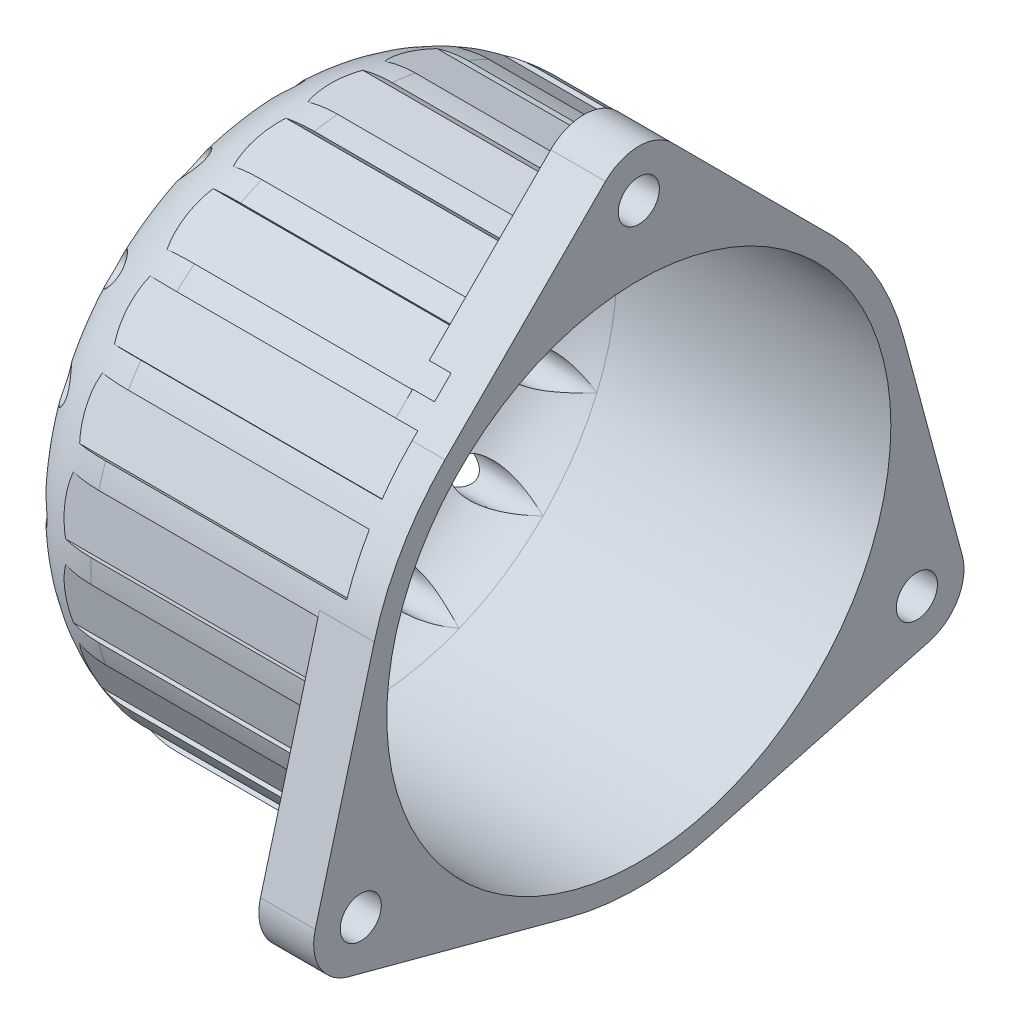
from build123d import *

# Parameters (mm, degrees)
SKETCH1_R               = 63.5
BOSS_EXTRUDE2_DEPTH     = 88.9
FILLET3_R               = 25.4
SHELL2_T                = 5.08
CUT_EXTRUDE1_START      = -5.08
SKETCH4_R               = 58.42
CUT_EXTRUDE1_DEPTH      = 5.08
CUT_EXTRUDE5_START      = -26
CUT_EXTRUDE5_OUTLINE_R  = 3.81
CUT_EXTRUDE5_DEPTH      = 26
CIRPATTERN3_START       = -1e-07
CIRPATTERN3_OUTLINE_R   = 3.81
CIRPATTERN3_DEPTH       = 26.0000001
BOSS_EXTRUDE3_START     = -12.7
SKETCH12_R              = 4.7625
BOSS_EXTRUDE3_DEPTH     = 12.7
CUT_EXTRUDE7_DEPTH      = 139.63281844
CUT_EXTRUDE7_DEPTH_BACK = 139.63281844
SKETCH13_R              = 10.16
SKETCH14_W              = 12.7
SKETCH14_H              = 2.54
CUT_EXTRUDE12_DEPTH     = 81.28
CIRPATTERN15_COUNT      = 22
CIRPATTERN18_COUNT      = 3


with BuildPart() as part:
    # Sketch1 → Boss-Extrude2 (new body)
    with BuildSketch(Plane(origin=(0, 0, 0), x_dir=(0, 0, -1), z_dir=(1, 0, 0))):
        Circle(SKETCH1_R)
    extrude(amount=BOSS_EXTRUDE2_DEPTH)

    # Fillet3
    fillet3_edges = [part.edges().sort_by_distance(p)[0] for p in [
        (0, 0, 63.5),
    ]]
    fillet(fillet3_edges, radius=FILLET3_R)

    # Shell2 (no face opened: a closed hollow body)
    add(offset(amount=-SHELL2_T, mode=Mode.PRIVATE), mode=Mode.SUBTRACT)

    # Sketch4 → Cut-Extrude1 (cut)
    with BuildSketch(Plane(origin=(88.9, 0, 0), x_dir=(0, 0, -1), z_dir=(1, 0, 0)).offset(CUT_EXTRUDE1_START)):
        with Locations(Location((0, 0, 0), (0, 0, 180))):
            Circle(SKETCH4_R)
    extrude(amount=CUT_EXTRUDE1_DEPTH, mode=Mode.SUBTRACT)

    # Cut-Extrude5: read off the stored shape, not the designer's step
    # Cut-Extrude5 outline → Cut-Extrude5 (cut)
    with BuildSketch(Plane.ZY.offset(CUT_EXTRUDE5_START)):
        with Locations((0, 54.61)):
            Circle(CUT_EXTRUDE5_OUTLINE_R)
        with Locations((-21.356899016, 50.260670155)):
            Circle(CUT_EXTRUDE5_OUTLINE_R)
        with Locations((-9.377034879, 46.044883721)):
            Circle(CUT_EXTRUDE5_OUTLINE_R)
        with Locations((9.377034879, 46.044883721)):
            Circle(CUT_EXTRUDE5_OUTLINE_R)
    extrude(amount=CUT_EXTRUDE5_DEPTH, mode=Mode.SUBTRACT)

    # CirPattern3: read off the stored shape, not the designer's step
    # CirPattern3 outline → CirPattern3 (cut)
    with BuildSketch(Plane.YZ.offset(CIRPATTERN3_START)):
        with Locations((25.928084568, 39.189214469)):
            Circle(CIRPATTERN3_OUTLINE_R)
        with Locations((-9.377034879, 46.044883721)):
            Circle(CIRPATTERN3_OUTLINE_R)
        with Locations((-39.189214469, 25.928084568)):
            Circle(CIRPATTERN3_OUTLINE_R)
        with Locations((-46.044883721, -9.377034879)):
            Circle(CIRPATTERN3_OUTLINE_R)
        with Locations((-25.928084568, -39.189214469)):
            Circle(CIRPATTERN3_OUTLINE_R)
        with Locations((9.377034879, -46.044883721)):
            Circle(CIRPATTERN3_OUTLINE_R)
        with Locations((39.189214469, -25.928084568)):
            Circle(CIRPATTERN3_OUTLINE_R)
        with Locations((38.615101321, -38.615101321)):
            Circle(CIRPATTERN3_OUTLINE_R)
        with Locations((38.615101321, 38.615101321)):
            Circle(CIRPATTERN3_OUTLINE_R)
        with Locations((0, 54.61)):
            Circle(CIRPATTERN3_OUTLINE_R)
        with Locations((-38.615101321, 38.615101321)):
            Circle(CIRPATTERN3_OUTLINE_R)
        with Locations((-54.61, 0)):
            Circle(CIRPATTERN3_OUTLINE_R)
        with Locations((-38.615101321, -38.615101321)):
            Circle(CIRPATTERN3_OUTLINE_R)
        with Locations((0, -54.61)):
            Circle(CIRPATTERN3_OUTLINE_R)
        with Locations((20.438052574, -50.641268813)):
            Circle(CIRPATTERN3_OUTLINE_R)
        with Locations((-21.356899016, -50.260670155)):
            Circle(CIRPATTERN3_OUTLINE_R)
        with Locations((-50.641268813, -20.438052574)):
            Circle(CIRPATTERN3_OUTLINE_R)
        with Locations((-50.260670155, 21.356899016)):
            Circle(CIRPATTERN3_OUTLINE_R)
        with Locations((-20.438052574, 50.641268813)):
            Circle(CIRPATTERN3_OUTLINE_R)
        with Locations((21.356899016, 50.260670155)):
            Circle(CIRPATTERN3_OUTLINE_R)
        with Locations((50.641268813, 20.438052574)):
            Circle(CIRPATTERN3_OUTLINE_R)
        with Locations((25.928084568, -39.189214469)):
            Circle(CIRPATTERN3_OUTLINE_R)
        with Locations((-9.377034879, -46.044883721)):
            Circle(CIRPATTERN3_OUTLINE_R)
        with Locations((-39.189214469, -25.928084567)):
            Circle(CIRPATTERN3_OUTLINE_R)
        with Locations((-46.044883721, 9.377034879)):
            Circle(CIRPATTERN3_OUTLINE_R)
        with Locations((-25.928084567, 39.189214469)):
            Circle(CIRPATTERN3_OUTLINE_R)
        with Locations((9.377034879, 46.044883721)):
            Circle(CIRPATTERN3_OUTLINE_R)
        with Locations((39.189214469, 25.928084567)):
            Circle(CIRPATTERN3_OUTLINE_R)
    extrude(amount=CIRPATTERN3_DEPTH, mode=Mode.SUBTRACT)

    # Sketch12 → Boss-Extrude3 (add)
    with BuildSketch(Plane(origin=(88.9, 0, 0), x_dir=(0, 0, -1), z_dir=(1, 0, 0)).offset(BOSS_EXTRUDE3_START)):
        with BuildLine():
            Line((-7.729809299, 82.138225256), (-44.940751738, 44.861774744))
            ThreePointArc((-44.940751738, 44.861774744), (0, 63.5), (44.940751738, 44.861774744))
            Line((44.940751738, 44.861774744), (7.729809299, 82.138225256))
            ThreePointArc((7.729809299, 82.138225256), (0, 85.344), (-7.729809299, 82.138225256))
        make_face()
        with Locations((0, 74.422)):
            Circle(SKETCH12_R, mode=Mode.SUBTRACT)
    boss_extrude3 = extrude(amount=BOSS_EXTRUDE3_DEPTH)

    # Sketch13 → Cut-Extrude7 (cut, two sides: drawn at the far end of the back side and taken through both)
    with BuildSketch(Plane.ZY.offset(-CUT_EXTRUDE7_DEPTH_BACK)):
        with Locations(Location((0, 0, 0), (0, 0, 180))):
            Circle(SKETCH13_R)
    extrude(amount=CUT_EXTRUDE7_DEPTH + CUT_EXTRUDE7_DEPTH_BACK, mode=Mode.SUBTRACT)

    # Sketch14 → Cut-Extrude12 (cut)
    with BuildSketch(Plane.ZY):
        with Locations((0, 63.5)):
            Rectangle(SKETCH14_W, SKETCH14_H)
    cut_extrude12 = extrude(amount=-CUT_EXTRUDE12_DEPTH, mode=Mode.SUBTRACT)

    # CirPattern15: Cut-Extrude12 ×22 about axis
    cirpattern15_axis = Axis((0, 0, 0), (1, 0, 0))
    for i in range(1, CIRPATTERN15_COUNT):
        add(cut_extrude12.rotate(cirpattern15_axis, i * 360 / CIRPATTERN15_COUNT), mode=Mode.SUBTRACT)

    # CirPattern18: Boss-Extrude3 ×3 about axis
    cirpattern18_axis = Axis((88.9, 0, 0), (-1, 0, 0))
    for i in range(1, CIRPATTERN18_COUNT):
        add(boss_extrude3.rotate(cirpattern18_axis, i * 360 / CIRPATTERN18_COUNT))


solid = part.part
